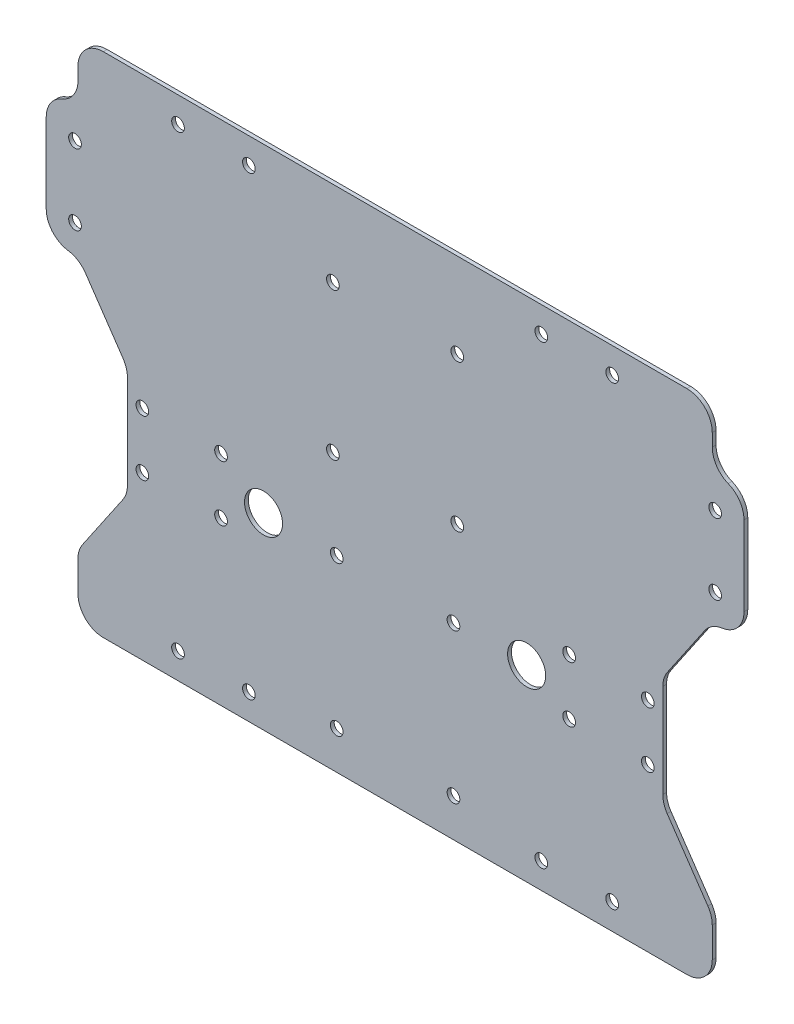
from build123d import *

# Parameters (mm, degrees)
SKETCH1_W               = 300
SKETCH1_H               = 200
BOSS_EXTRUDE1_DEPTH     = 1.5
CUT_EXTRUDE1_DEPTH      = 361.558247722
CUT_EXTRUDE1_DEPTH_BACK = 361.558247722
SKETCH3_R               = 7.5
SKETCH5_R               = 2.5
CUT_EXTRUDE2_DEPTH      = 351.226355376
FILLET1_R               = 10
FILLET2_R               = 10


with BuildPart() as part:
    # Sketch1 → Boss-Extrude1 (new body)
    with BuildSketch(Plane.XY):
        with Locations((150, 100)):
            Rectangle(SKETCH1_W, SKETCH1_H)
    extrude(amount=-BOSS_EXTRUDE1_DEPTH)

    # Sketch3 → Cut-Extrude1 (cut, two sides: drawn at the far end of the back side and taken through both)
    with BuildSketch(Plane.XY.offset(-CUT_EXTRUDE1_DEPTH_BACK)):
        Polygon((0, 0), (25, 0), (25, 25), (44.5, 53.591472049), (44.5, 96.687392097), (25, 125.278864146), (12.5, 125.278864146), (12.5, 175), (25, 175), (25, 200), (0, 200), align=None)
        Polygon((275, 25), (275, 0), (300, 0), (300, 200), (275, 200), (275, 175), (287.5, 175), (287.5, 125.278864146), (275, 125.278864146), (255.5, 96.687392097), (255.5, 53.591472049), align=None)
        with Locations((201.85, 74.125843129)):
            Circle(SKETCH3_R)
        with Locations((98.15, 74.125843129)):
            Circle(SKETCH3_R)
    extrude(amount=CUT_EXTRUDE1_DEPTH + CUT_EXTRUDE1_DEPTH_BACK, mode=Mode.SUBTRACT)

    # Sketch5 → Cut-Extrude2 (cut, symmetric)
    with BuildSketch(Plane.XY):
        with Locations((64.44, 10.16)):
            Circle(SKETCH5_R)
    cut_extrude2 = extrude(amount=CUT_EXTRUDE2_DEPTH, both=True, mode=Mode.SUBTRACT)

    # Sketch-Pattern1: Cut-Extrude2 at 27 more places
    with Locations((-40.59, 153.81, 0), (-40.59, 125.87, 0), (0, 179.68, 0), (27.94, 179.68, 0), (143.18, 179.68, 0), (171.12, 179.68, 0), (211.71, 153.81, 0), (211.71, 125.87, 0), (143.18, 0, 0), (171.12, 0, 0), (27.94, 0, 0), (62.56, 4.84, 0), (108.56, 4.84, 0), (62.56, 63.84, 0), (108.56, 63.84, 0), (61.06, 98.34, 0), (110.06, 98.34, 0), (61.06, 156.34, 0), (110.06, 156.34, 0), (154.16, 75.84, 0), (185.16, 75.84, 0), (185.16, 53.84, 0), (154.16, 53.84, 0), (16.96, 53.846294, 0), (-14.04, 53.846294, 0), (16.96, 75.846294, 0), (-14.04, 75.846294, 0)):
        add(cut_extrude2, mode=Mode.SUBTRACT)

    # Fillet1
    fillet1_edges = [part.edges().sort_by_distance(p)[0] for p in [
        (25, 0, -0.75),
        (25, 25, -0.75),
        (44.5, 53.591472049, -0.75),
        (44.5, 96.687392097, -0.75),
        (25, 125.278864146, -0.75),
        (25, 175, -0.75),
        (25, 200, -0.75),
        (275, 200, -0.75),
        (275, 175, -0.75),
        (275, 125.278864146, -0.75),
        (255.5, 96.687392097, -0.75),
        (255.5, 53.591472049, -0.75),
        (275, 25, -0.75),
        (275, 0, -0.75),
    ]]
    fillet(fillet1_edges, radius=FILLET1_R)

    # Fillet2
    fillet2_edges = [part.edges().sort_by_distance(p)[0] for p in [
        (287.5, 175, -0.75),
        (287.5, 125.278864146, -0.75),
        (12.5, 175, -0.75),
        (12.5, 125.278864146, -0.75),
    ]]
    fillet(fillet2_edges, radius=FILLET2_R)


solid = part.part
